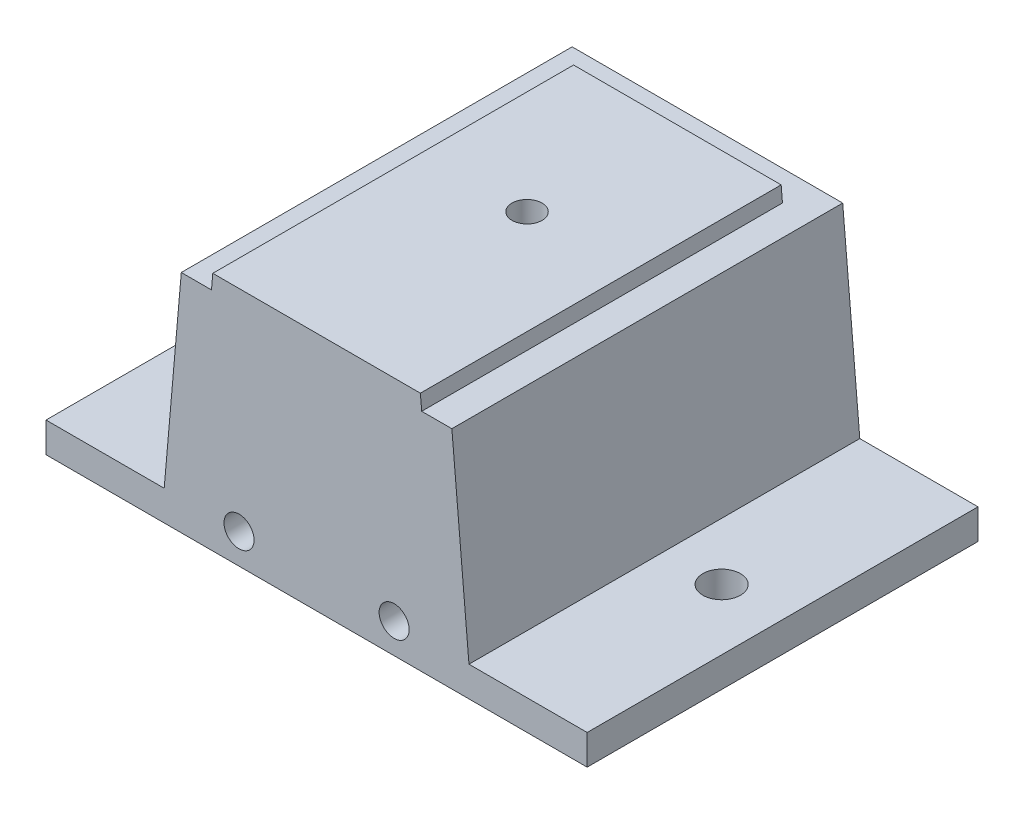
from build123d import *

# Parameters (mm, degrees)
BOSS_EXTRUDE1_DEPTH         = 41.275
SHELL1_START                = -34.925
SHELL1_DEPTH                = 69.85
CUT_EXTRUDE2_DEPTH          = 87.892969365
CUT_EXTRUDE2_DEPTH_BACK     = 87.892969365
SKETCH7_W                   = 6.35
SKETCH7_H                   = 3.175
SKETCH8_R                   = 3.96875
CUT_EXTRUDE3_DEPTH          = 120.685287839
F_1_4_0_25_DIAMETER_HOLE1_D = 6.35
F_1_4_0_25_DIAMETER_HOLE2_D = 6.35


# Read off the part's stored shape, not the designer's step: Shell1
with BuildPart() as part:
    # Sketch1 → Boss-Extrude1 (new, symmetric)
    with BuildSketch(Plane.XY):
        Polygon((57.15, 0), (-57.15, 0), (-57.15, 6.35), (-32.186094587, 6.35), (-28.575, 47.625), (-22.200744032, 47.625), (-21.922967525, 50.8), (21.922967525, 50.8), (22.200744032, 47.625), (28.575, 47.625), (32.186094587, 6.35), (57.15, 6.35), align=None)
    extrude(amount=BOSS_EXTRUDE1_DEPTH, both=True)

    # Shell1 outline → Shell1 (cut)
    with BuildSketch(Plane.XY.offset(SHELL1_START)):
        Polygon((26.367391632, 0), (22.756297045, 41.275), (16.382041077, 41.275), (16.10426457, 44.45), (-16.10426457, 44.45), (-16.382041077, 41.275), (-22.756297045, 41.275), (-26.367391632, 0), align=None)
    extrude(amount=SHELL1_DEPTH, mode=Mode.SUBTRACT)

    # Sketch7 → Cut-Extrude2 (cut, two sides: drawn at the far end of the back side and taken through both)
    with BuildSketch(Plane(origin=(0, 0, 0), x_dir=(0, 0, -1), z_dir=(1, 0, 0)).offset(-CUT_EXTRUDE2_DEPTH_BACK)):
        with Locations((38.1, 49.2125)):
            Rectangle(SKETCH7_W, SKETCH7_H)
    extrude(amount=CUT_EXTRUDE2_DEPTH + CUT_EXTRUDE2_DEPTH_BACK, mode=Mode.SUBTRACT)

    # Sketch8 → Cut-Extrude3 (cut, through all)
    with BuildSketch(Plane(origin=(0, 0, -50.8), x_dir=(1, 0, 0), z_dir=(0, 1, 0))):
        with Locations((44.278106598, -50.8)):
            Circle(SKETCH8_R)
        with Locations(Location((-44.278106598, -50.8, 0), (0, 0, 90))):
            Circle(SKETCH8_R)
    extrude(amount=CUT_EXTRUDE3_DEPTH, mode=Mode.SUBTRACT)

    # 1/4 (0.25) Diameter Hole1 (through all)
    with Locations(Plane(origin=(0, 50.8, 0), x_dir=(1, 0, 0), z_dir=(0, 1, 0))):
        with Locations((0, 3.175)):
            Hole(F_1_4_0_25_DIAMETER_HOLE1_D / 2)

    # 1/4 (0.25) Diameter Hole2 (through all)
    with Locations(Plane(origin=(0, 0, -41.275), x_dir=(-1, 0, 0), z_dir=(0, 0, -1))):
        with Locations((-16.382041077, 6.35), (16.382041077, 6.35)):
            Hole(F_1_4_0_25_DIAMETER_HOLE2_D / 2)


solid = part.part
